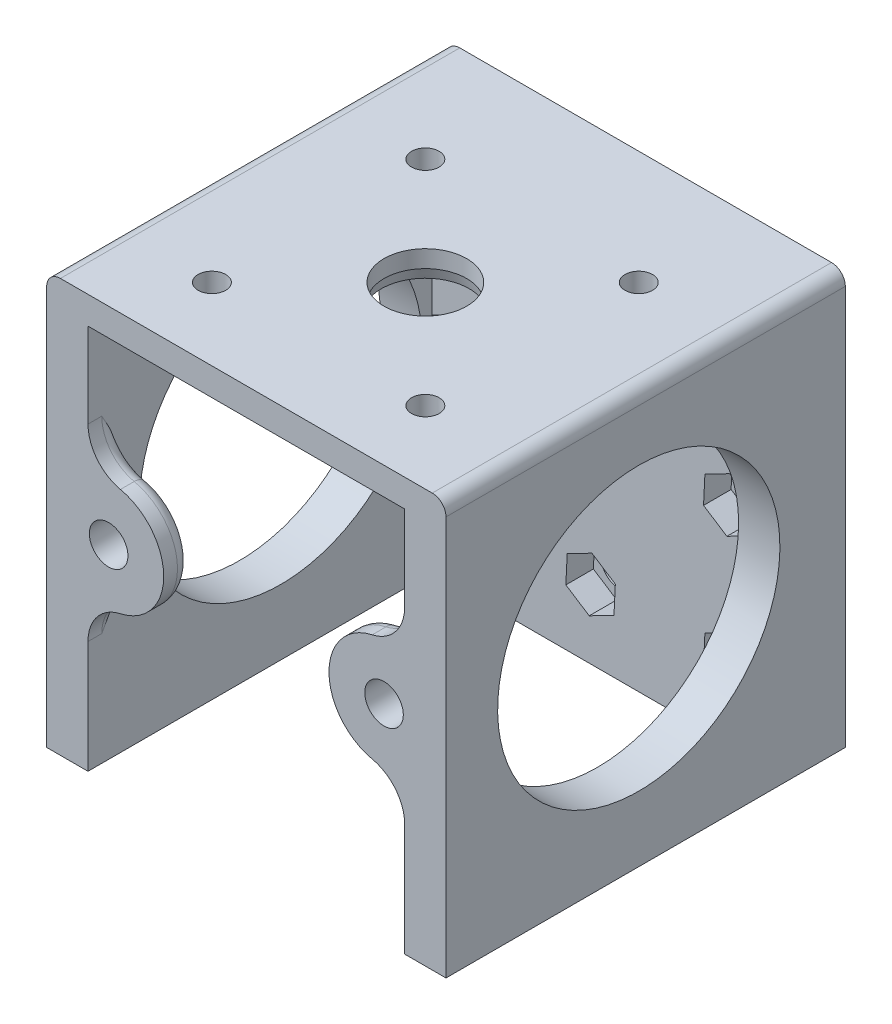
from build123d import *
from OCP.BRepFilletAPI import BRepFilletAPI_MakeChamfer

# Parameters (mm, degrees)
SKIZZE1_W                       = 58
SKIZZE1_H                       = 60
SKIZZE1_R                       = 2.4
SKIZZE1_R_2                     = 1.6
AUFSATZ_LINEAR_AUSTRAGEN1_DEPTH = 8
AUFSATZ_LINEAR_AUSTRAGEN2_DEPTH = 50
SKIZZE5_R                       = 6
SKIZZE5_R_2                     = 2
SCHNITT_LINEAR_AUSTRAGEN1_DEPTH = 8
SKIZZE10_R                      = 8
SKIZZE10_R_2                    = 2.8
AUFSATZ_LINEAR_AUSTRAGEN3_DEPTH = 4
VERRUNDUNG1_R                   = 6
VERRUNDUNG3_R                   = 2
SKIZZE11_R                      = 2.8
SCHNITT_LINEAR_AUSTRAGEN7_DEPTH = 4
FASE3_SIZE                      = 0.4
FASE3_SIZE2                     = 1.492820323
VERRUNDUNG4_R                   = 2
FASE4_SIZE                      = 4.5
FASE4_SIZE2                     = 1.205771366
SCHNITT_LINEAR_AUSTRAGEN8_DEPTH = 4
LINEARES_MUSTER1_COUNT          = 3
LINEARES_MUSTER1_PITCH          = 20
LINEARES_MUSTER1_COUNT_DIR2     = 3
LINEARES_MUSTER1_PITCH_DIR2     = 20
SKIZZE13_R                      = 20.5
SCHNITT_LINEAR_AUSTRAGEN9_DEPTH = 60


with BuildPart() as part:
    # Skizze1 → Aufsatz-Linear austragen1 (new body)
    with BuildSketch(Plane.XY):
        with Locations((0, -30)):
            Rectangle(SKIZZE1_W, SKIZZE1_H)
        with Locations((-20, -10)):
            Circle(SKIZZE1_R, mode=Mode.SUBTRACT)
        with Locations((0, -10)):
            Circle(SKIZZE1_R, mode=Mode.SUBTRACT)
        with Locations((20, -10)):
            Circle(SKIZZE1_R, mode=Mode.SUBTRACT)
        with Locations((0, -30)):
            Circle(SKIZZE1_R, mode=Mode.SUBTRACT)
        with Locations((20, -30)):
            Circle(SKIZZE1_R, mode=Mode.SUBTRACT)
        with Locations((0, -50)):
            Circle(SKIZZE1_R, mode=Mode.SUBTRACT)
        with Locations((20, -50)):
            Circle(SKIZZE1_R, mode=Mode.SUBTRACT)
        with Locations((-20, -30)):
            Circle(SKIZZE1_R, mode=Mode.SUBTRACT)
        with Locations((-20, -50)):
            Circle(SKIZZE1_R, mode=Mode.SUBTRACT)
        with Locations((-10, -20)):
            Circle(SKIZZE1_R_2, mode=Mode.SUBTRACT)
        with Locations((10, -20)):
            Circle(SKIZZE1_R_2, mode=Mode.SUBTRACT)
    extrude(amount=AUFSATZ_LINEAR_AUSTRAGEN1_DEPTH)

    # Skizze4 → Aufsatz-Linear austragen2 (add)
    with BuildSketch(Plane.XY.offset(8)):
        Polygon((29, 0), (-29, 0), (-29, -59.997453527), (-23, -59.997453527), (-23, -4), (23, -4), (23, -59.997453527), (29, -59.997453527), align=None)
    extrude(amount=AUFSATZ_LINEAR_AUSTRAGEN2_DEPTH)

    # Skizze5 → Schnitt-Linear austragen1 (cut)
    with BuildSketch(Plane(origin=(0, 0, 0), x_dir=(1, 0, 0), z_dir=(0, 1, 0))):
        with Locations(Location((0, -32, 0), (0, 0, 180))):
            Circle(SKIZZE5_R)
        with Locations(Location((-15.5, -16.5, 0), (0, 0, 180))):
            Circle(SKIZZE5_R_2)
        with Locations(Location((15.5, -16.5, 0), (0, 0, 180))):
            Circle(SKIZZE5_R_2)
        with Locations(Location((15.5, -47.5, 0), (0, 0, 180))):
            Circle(SKIZZE5_R_2)
        with Locations(Location((-15.5, -47.5, 0), (0, 0, 180))):
            Circle(SKIZZE5_R_2)
    extrude(amount=-SCHNITT_LINEAR_AUSTRAGEN1_DEPTH, mode=Mode.SUBTRACT)

    # Skizze10 → Aufsatz-Linear austragen3 (add)
    # profile 1 of 2: a face of its own
    with BuildSketch(Plane.XY.offset(58)):
        with Locations((20, -30)):
            Circle(SKIZZE10_R)
    # profile 2 of 2: a face of its own
    with BuildSketch(Plane.XY.offset(58)):
        with Locations((-20, -30)):
            Circle(SKIZZE10_R)
        with Locations((-20, -30)):
            Circle(SKIZZE10_R_2, mode=Mode.SUBTRACT)
    extrude(amount=-AUFSATZ_LINEAR_AUSTRAGEN3_DEPTH)

    # Verrundung1
    verrundung1_edges = [part.edges().sort_by_distance(p)[0] for p in [
        (23, -37.416198487, 56),
        (23, -22.583801513, 56),
        (-23, -37.416198487, 56),
        (-23, -22.583801513, 56),
    ]]
    fillet(verrundung1_edges, radius=VERRUNDUNG1_R)

    # Verrundung3
    # the kernel refuses this fillet: 2 mm, written as the material it takes off along each edge
    with BuildSketch(Plane(origin=(-20, -30, 54), x_dir=(0.21428571428571433, -0.9767710236555245, 0), z_dir=(-0.9767710236555245, -0.21428571428571433, 0))) as verrundung3_piece_1:
        with BuildLine():
            CenterArc((8 - VERRUNDUNG3_R, VERRUNDUNG3_R), VERRUNDUNG3_R, 270, 90)
            Line((8 - VERRUNDUNG3_R, 0), (8, 0))
            Line((8, 0), (8, VERRUNDUNG3_R))
        make_face()
    revolve(axis=Axis((-20, -30, 54), (0, 0, 1)), revolution_arc=155.252749768, mode=Mode.SUBTRACT)
    with BuildSketch(Plane(origin=(20, -30, 54), x_dir=(-0.21428571428571347, 0.9767710236555247, 0), z_dir=(0.9767710236555247, 0.21428571428571347, 0))) as verrundung3_piece_2:
        with BuildLine():
            CenterArc((8 - VERRUNDUNG3_R, VERRUNDUNG3_R), VERRUNDUNG3_R, 270, 90)
            Line((8 - VERRUNDUNG3_R, 0), (8, 0))
            Line((8, 0), (8, VERRUNDUNG3_R))
        make_face()
    revolve(axis=Axis((20, -30, 54), (0, 0, 1)), revolution_arc=155.252749768, mode=Mode.SUBTRACT)
    with BuildSketch(Plane(origin=(-17, -16.325205669, 54), x_dir=(-0.6722279054593165, 0.7403442733767718, 0), z_dir=(0.7403442733767718, 0.6722279054593165, 0))) as verrundung3_piece_3_section:
        with BuildLine():
            CenterArc((6 + VERRUNDUNG3_R, VERRUNDUNG3_R), VERRUNDUNG3_R, 180, 90)
            Line((6 + VERRUNDUNG3_R, 0), (6, 0))
            Line((6, 0), (6, VERRUNDUNG3_R))
        make_face()
    verrundung3_piece_3 = revolve(axis=Axis((-17, -16.325205669, 54), (0, 0, 1)), revolution_arc=125.387125524, mode=Mode.PRIVATE)
    verrundung3_piece_3 = split(verrundung3_piece_3, bisect_by=Plane(origin=(-23, -20.355034942, 54.516064296), z_dir=(1, 0, 0)), keep=Keep.TOP, mode=Mode.PRIVATE)
    add(verrundung3_piece_3, mode=Mode.SUBTRACT)
    with BuildSketch(Plane(origin=(-17, -43.674794331, 54), x_dir=(-0.6722279054593165, -0.7403442733767718, 0), z_dir=(0.7403442733767718, -0.6722279054593165, 0))) as verrundung3_piece_4_section:
        with BuildLine():
            CenterArc((6 + VERRUNDUNG3_R, -VERRUNDUNG3_R), VERRUNDUNG3_R, 90, 90)
            Line((6, -VERRUNDUNG3_R), (6, 0))
            Line((6, 0), (6 + VERRUNDUNG3_R, 0))
        make_face()
    verrundung3_piece_4 = revolve(axis=Axis((-17, -43.674794331, 54), (0, 0, -1)), revolution_arc=125.387125524, mode=Mode.PRIVATE)
    verrundung3_piece_4 = split(verrundung3_piece_4, bisect_by=Plane(origin=(-23, -39.644965239, 54.51606418), z_dir=(1, 0, 0)), keep=Keep.TOP, mode=Mode.PRIVATE)
    add(verrundung3_piece_4, mode=Mode.SUBTRACT)
    with BuildSketch(Plane(origin=(17, -43.674794331, 54), x_dir=(0.6722279054593165, -0.7403442733767718, 0), z_dir=(-0.7403442733767718, -0.6722279054593165, 0))) as verrundung3_piece_5_section:
        with BuildLine():
            CenterArc((6 + VERRUNDUNG3_R, VERRUNDUNG3_R), VERRUNDUNG3_R, 180, 90)
            Line((6 + VERRUNDUNG3_R, 0), (6, 0))
            Line((6, 0), (6, VERRUNDUNG3_R))
        make_face()
    verrundung3_piece_5 = revolve(axis=Axis((17, -43.674794331, 54), (0, 0, 1)), revolution_arc=125.387125524, mode=Mode.PRIVATE)
    verrundung3_piece_5 = split(verrundung3_piece_5, bisect_by=Plane(origin=(23, -39.644965059, 54.516064297), z_dir=(-1, 0, 0)), keep=Keep.TOP, mode=Mode.PRIVATE)
    add(verrundung3_piece_5, mode=Mode.SUBTRACT)
    with BuildSketch(Plane(origin=(17, -16.325205669, 54), x_dir=(0.6722279054593165, 0.7403442733767718, 0), z_dir=(-0.7403442733767718, 0.6722279054593165, 0))) as verrundung3_piece_6_section:
        with BuildLine():
            CenterArc((6 + VERRUNDUNG3_R, -VERRUNDUNG3_R), VERRUNDUNG3_R, 90, 90)
            Line((6, -VERRUNDUNG3_R), (6, 0))
            Line((6, 0), (6 + VERRUNDUNG3_R, 0))
        make_face()
    verrundung3_piece_6 = revolve(axis=Axis((17, -16.325205669, 54), (0, 0, -1)), revolution_arc=125.387125524, mode=Mode.PRIVATE)
    verrundung3_piece_6 = split(verrundung3_piece_6, bisect_by=Plane(origin=(23, -20.355037545, 54.516064214), z_dir=(-1, 0, 0)), keep=Keep.TOP, mode=Mode.PRIVATE)
    add(verrundung3_piece_6, mode=Mode.SUBTRACT)

    # Skizze11 → Schnitt-Linear austragen7 (cut)
    with BuildSketch(Plane.XY.offset(58)):
        with Locations((20, -30)):
            Circle(SKIZZE11_R)
    extrude(amount=-SCHNITT_LINEAR_AUSTRAGEN7_DEPTH, mode=Mode.SUBTRACT)

    # Fase3
    fase3_edges = [part.edges().sort_by_distance(p)[0] for p in [
        (6, -4, 32),
    ]]
    fase3_side = [part.faces().sort_by_distance(p)[0] for p in [
        (-22.32058849, -4, 33),
    ]]
    chamfer(fase3_edges, length=FASE3_SIZE, length2=FASE3_SIZE2, reference=fase3_side[0])

    # Verrundung4
    verrundung4_edges = [part.edges().sort_by_distance(p)[0] for p in [
        (-29, 0, 29),
        (29, 0, 29),
    ]]
    fillet(verrundung4_edges, radius=VERRUNDUNG4_R)

    # Fase4: one chamfer whose edges measure the first distance from different faces: ONE call of the kernel's chamfer builder (chamfer() names one face for all edges)
    fase4_edges_1 = [part.edges().sort_by_distance(p)[0] for p in [
        (-11.6, -20, 0),
    ]]
    fase4_side_1 = [part.faces().sort_by_distance(p)[0] for p in [
        (-11.6, -20, 4),
    ]]
    fase4_edges_2 = [part.edges().sort_by_distance(p)[0] for p in [
        (8.4, -20, 0),
    ]]
    fase4_side_2 = [part.faces().sort_by_distance(p)[0] for p in [
        (8.4, -20, 4),
    ]]
    fase4 = BRepFilletAPI_MakeChamfer(part.part.solid().wrapped)
    for e in fase4_edges_1:
        fase4.Add(FASE4_SIZE, FASE4_SIZE2, e.wrapped, fase4_side_1[0].wrapped)  # the first distance lies on this face
    for e in fase4_edges_2:
        fase4.Add(FASE4_SIZE, FASE4_SIZE2, e.wrapped, fase4_side_2[0].wrapped)  # the first distance lies on this face
    add(Compound.cast(fase4.Shape()), mode=Mode.REPLACE)

    # Skizze12 → Schnitt-Linear austragen8 (cut)
    with BuildSketch(Plane.XY.offset(8)):
        Polygon((-16.6027319, -12.189041523), (-16.405600381, -8.152400284), (-19.802868481, -5.96335876), (-23.3972681, -7.810958477), (-23.594399619, -11.847599716), (-20.197131519, -14.03664124), align=None)
    schnitt_linear_austragen8 = extrude(amount=-SCHNITT_LINEAR_AUSTRAGEN8_DEPTH, mode=Mode.SUBTRACT)

    # Lineares Muster1: Schnitt-Linear austragen8 3 × 3
    with Locations(*[(i * LINEARES_MUSTER1_PITCH, -j * LINEARES_MUSTER1_PITCH_DIR2, 0) for i in range(LINEARES_MUSTER1_COUNT) for j in range(LINEARES_MUSTER1_COUNT_DIR2) if (i, j) != (0, 0)]):
        add(schnitt_linear_austragen8, mode=Mode.SUBTRACT)

    # Skizze13 → Schnitt-Linear austragen9 (cut)
    with BuildSketch(Plane(origin=(29, 0, 0), x_dir=(0, 0, -1), z_dir=(1, 0, 0))):
        with Locations(Location((-30, -30, 0), (0, 0, 90))):
            Circle(SKIZZE13_R)
    extrude(amount=-SCHNITT_LINEAR_AUSTRAGEN9_DEPTH, mode=Mode.SUBTRACT)


solid = part.part
